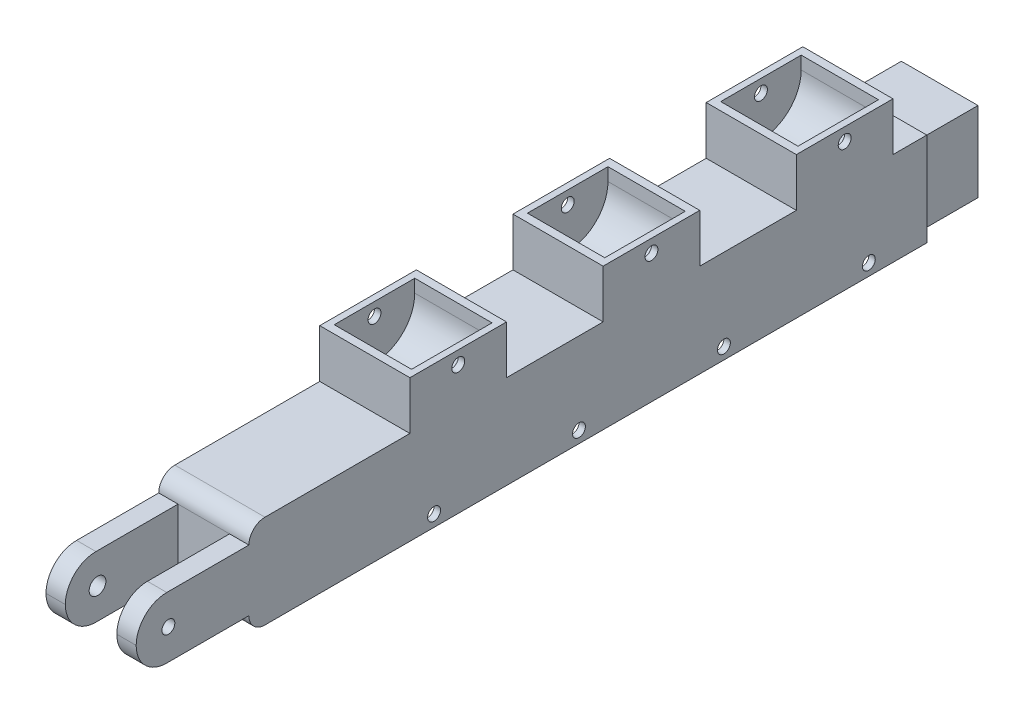
from build123d import *

# Parameters (mm, degrees)
SKETCH_1_W           = 250
SKETCH_1_H           = 29
SKETCH_1_W_2         = 30
SKETCH_1_H_2         = 15
EXTRUDE_1_DEPTH      = 28
SKETCH_1_3_R         = 2
CUT_EXTRUDE_1_DEPTH  = 132.450561049
CUT_EXTRUDE_START    = 2
SKETCH_1_5_R         = 2
CUT_EXTRUDE_2_DEPTH  = 24
SKETCH_3_W           = 6
SKETCH_3_H           = 19
EXTRUDE_2_DEPTH      = 35
SKETCH_3_3_W         = 6
SKETCH_3_3_H         = 19
EXTRUDE_3_DEPTH      = 35
SKETCH_1_6_R         = 2
CUT_EXTRUDE_3_DEPTH  = 166.088612569
CUT_EXTRUDE_7_REACH  = 167.089
SKETCH_1_8_R         = 2.6
FILLET_1_R           = 9.5
FILLET_2_R           = 5
SKETCH_4_R           = 5.1
CUT_EXTRUDE_4_DEPTH  = 31.5
SKETCH_4_2_OUTSIDE_W = 87.946
SKETCH_4_2_OUTSIDE_H = 103.946
SKETCH_4_2_OUTSIDE_R = 5.1
CUT_EXTRUDE_5_DEPTH  = 21.5
SKETCH_5_OUTSIDE_W   = 83.722
SKETCH_5_OUTSIDE_H   = 99.722
SKETCH_5_OUTSIDE_W_2 = 23.8
SKETCH_5_OUTSIDE_H_2 = 24.8
CUT_EXTRUDE_6_DEPTH  = 18


with BuildPart() as part:
    # 草图1 → 凸台-拉伸1 (new body)
    with BuildSketch(Plane(origin=(0, 0, 0), x_dir=(0, 0, -1), z_dir=(1, 0, 0))):
        Rectangle(SKETCH_1_W, SKETCH_1_H)
        with Locations((-60, 22)):
            Rectangle(SKETCH_1_W_2, SKETCH_1_H_2)
        with Locations((0, 22)):
            Rectangle(SKETCH_1_W_2, SKETCH_1_H_2)
        with Locations((60, 22)):
            Rectangle(SKETCH_1_W_2, SKETCH_1_H_2)
    extrude(amount=EXTRUDE_1_DEPTH)

    # 草图1<3> → 切除-拉伸1 (cut, through all)
    with BuildSketch(Plane(origin=(0, 0, 0), x_dir=(0, 0, -1), z_dir=(1, 0, 0))):
        with Locations((-67.5, -10.858617882)):
            Circle(SKETCH_1_3_R)
        with Locations((-22.5, -10.858617882)):
            Circle(SKETCH_1_3_R)
        with Locations((22.5, -10.858617882)):
            Circle(SKETCH_1_3_R)
        with Locations((-60, 25.5)):
            Circle(SKETCH_1_3_R)
        with Locations((67.5, -10.858617882)):
            Circle(SKETCH_1_3_R)
        with Locations((0, 25.5)):
            Circle(SKETCH_1_3_R)
        with Locations((60, 25.5)):
            Circle(SKETCH_1_3_R)
    extrude(amount=CUT_EXTRUDE_1_DEPTH, mode=Mode.SUBTRACT)

    # 草图1<5> → 切除-拉伸2 (cut)
    # profile 1 of 7: a face of its own
    with BuildSketch(Plane(origin=(0, 0, 0), x_dir=(0, 0, -1), z_dir=(1, 0, 0)).offset(CUT_EXTRUDE_START)):
        with BuildLine():
            Line((-72.5, 29.5), (-72.5, 25.5))
            ThreePointArc((-72.5, 25.5), (-60, 13), (-47.5, 25.5))
            Line((-47.5, 25.5), (-47.5, 29.5))
            Line((-47.5, 29.5), (-72.5, 29.5))
        make_face()
        with Locations((-60, 25.5)):
            Circle(SKETCH_1_5_R, mode=Mode.SUBTRACT)
    # profile 2 of 7: a face of its own
    with BuildSketch(Plane(origin=(0, 0, 0), x_dir=(0, 0, -1), z_dir=(1, 0, 0)).offset(CUT_EXTRUDE_START)):
        with BuildLine():
            Line((-79.457856675, -14.5), (-55.542143325, -14.5))
            ThreePointArc((-55.542143325, -14.5), (-67.5, 1.641382118), (-79.457856675, -14.5))
        make_face()
        with Locations((-67.5, -10.858617882)):
            Circle(SKETCH_1_5_R, mode=Mode.SUBTRACT)
    # profile 3 of 7: a face of its own
    with BuildSketch(Plane(origin=(0, 0, 0), x_dir=(0, 0, -1), z_dir=(1, 0, 0)).offset(CUT_EXTRUDE_START)):
        with BuildLine():
            Line((-34.457856675, -14.5), (-10.542143325, -14.5))
            ThreePointArc((-10.542143325, -14.5), (-22.5, 1.641382118), (-34.457856675, -14.5))
        make_face()
        with Locations((-22.5, -10.858617882)):
            Circle(SKETCH_1_5_R, mode=Mode.SUBTRACT)
    # profile 4 of 7: a face of its own
    with BuildSketch(Plane(origin=(0, 0, 0), x_dir=(0, 0, -1), z_dir=(1, 0, 0)).offset(CUT_EXTRUDE_START)):
        with BuildLine():
            ThreePointArc((-12.5, 25.5), (0, 13), (12.5, 25.5))
            Line((12.5, 25.5), (12.5, 29.5))
            Line((12.5, 29.5), (-12.5, 29.5))
            Line((-12.5, 29.5), (-12.5, 25.5))
        make_face()
        with Locations((0, 25.5)):
            Circle(SKETCH_1_5_R, mode=Mode.SUBTRACT)
    # profile 5 of 7: a face of its own
    with BuildSketch(Plane(origin=(0, 0, 0), x_dir=(0, 0, -1), z_dir=(1, 0, 0)).offset(CUT_EXTRUDE_START)):
        with BuildLine():
            Line((10.542143325, -14.5), (34.457856675, -14.5))
            ThreePointArc((34.457856675, -14.5), (22.5, 1.641382118), (10.542143325, -14.5))
        make_face()
        with Locations((22.5, -10.858617882)):
            Circle(SKETCH_1_5_R, mode=Mode.SUBTRACT)
    # profile 6 of 7: a face of its own
    with BuildSketch(Plane(origin=(0, 0, 0), x_dir=(0, 0, -1), z_dir=(1, 0, 0)).offset(CUT_EXTRUDE_START)):
        with BuildLine():
            Line((55.542143325, -14.5), (79.457856675, -14.5))
            ThreePointArc((79.457856675, -14.5), (67.5, 1.641382118), (55.542143325, -14.5))
        make_face()
        with Locations((67.5, -10.858617882)):
            Circle(SKETCH_1_5_R, mode=Mode.SUBTRACT)
    # profile 7 of 7: a face of its own
    with BuildSketch(Plane(origin=(0, 0, 0), x_dir=(0, 0, -1), z_dir=(1, 0, 0)).offset(CUT_EXTRUDE_START)):
        with BuildLine():
            ThreePointArc((47.5, 25.5), (60, 13), (72.5, 25.5))
            Line((72.5, 25.5), (72.5, 29.5))
            Line((72.5, 29.5), (47.5, 29.5))
            Line((47.5, 29.5), (47.5, 25.5))
        make_face()
        with Locations((60, 25.5)):
            Circle(SKETCH_1_5_R, mode=Mode.SUBTRACT)
    extrude(amount=CUT_EXTRUDE_2_DEPTH, mode=Mode.SUBTRACT)

    # 草图3 → 凸台-拉伸2 (add)
    with BuildSketch(Plane.XY.offset(125)):
        with Locations((25, 0)):
            Rectangle(SKETCH_3_W, SKETCH_3_H)
    extrude(amount=EXTRUDE_2_DEPTH)

    # 草图3<3> → 凸台-拉伸3 (add)
    with BuildSketch(Plane.XY.offset(125)):
        with Locations((25, 0)):
            Rectangle(SKETCH_3_3_W, SKETCH_3_3_H)
        with Locations((3, 0)):
            Rectangle(SKETCH_3_3_W, SKETCH_3_3_H)
    extrude(amount=EXTRUDE_3_DEPTH)

    # 草图1<6> → 切除-拉伸3 (cut, through all)
    with BuildSketch(Plane(origin=(0, 0, 0), x_dir=(0, 0, -1), z_dir=(1, 0, 0))):
        with Locations(Location((-150, 0, 0), (0, 0, 90))):
            Circle(SKETCH_1_6_R)
    extrude(amount=CUT_EXTRUDE_3_DEPTH, mode=Mode.SUBTRACT)

    # 草图1<8> → 切除-拉伸7 (cut, up to next)
    with BuildSketch(Plane(origin=(0, 0, 0), x_dir=(0, 0, -1), z_dir=(1, 0, 0)), mode=Mode.PRIVATE) as cut_extrude_7_sk1:
        with Locations(Location((-150, 0, 0), (0, 0, 180))):
            Circle(SKETCH_1_8_R)
    cut_extrude_7_tool1 = extrude(cut_extrude_7_sk1.sketch, amount=CUT_EXTRUDE_7_REACH, mode=Mode.PRIVATE) & part.part
    add(cut_extrude_7_tool1.solids().sort_by_distance((0, 0, 150))[0], mode=Mode.SUBTRACT)

    # 圆角1
    fillet_1_edges = [part.edges().sort_by_distance(p)[0] for p in [
        (25, 9.5, 160),
        (25, -9.5, 160),
        (3, -9.5, 160),
        (3, 9.5, 160),
    ]]
    fillet(fillet_1_edges, radius=FILLET_1_R - 0.0001)  # a hair under: the kernel refuses the full size

    # 圆角2
    fillet_2_edges = [part.edges().sort_by_distance(p)[0] for p in [
        (14, -14.5, 125),
        (14, 14.5, 125),
    ]]
    fillet(fillet_2_edges, radius=FILLET_2_R)

    # 草图4 → 切除-拉伸4 (cut)
    with BuildSketch(Plane(origin=(0, 0, -125), x_dir=(-1, 0, 0), z_dir=(0, 0, -1))):
        with Locations((-14, 0)):
            Circle(SKETCH_4_R)
    extrude(amount=-CUT_EXTRUDE_4_DEPTH, mode=Mode.SUBTRACT)

    # 草图4<2> outside → 切除-拉伸5 (cut)
    with BuildSketch(Plane(origin=(0, 0, -125), x_dir=(-1, 0, 0), z_dir=(0, 0, -1))):
        with Locations((-14, 7.5)):
            Rectangle(SKETCH_4_2_OUTSIDE_W, SKETCH_4_2_OUTSIDE_H)
        with Locations((-14, 0)):
            Circle(SKETCH_4_2_OUTSIDE_R, mode=Mode.SUBTRACT)
    extrude(amount=-CUT_EXTRUDE_5_DEPTH, mode=Mode.SUBTRACT)

    # 草图5 outside → 切除-拉伸6 (cut)
    with BuildSketch(Plane(origin=(0, 0, -103.5), x_dir=(-1, 0, 0), z_dir=(0, 0, -1))):
        with Locations((-14, 7.5)):
            Rectangle(SKETCH_5_OUTSIDE_W, SKETCH_5_OUTSIDE_H)
        with Locations((-14, 0)):
            Rectangle(SKETCH_5_OUTSIDE_W_2, SKETCH_5_OUTSIDE_H_2, mode=Mode.SUBTRACT)
    extrude(amount=-CUT_EXTRUDE_6_DEPTH, mode=Mode.SUBTRACT)


solid = part.part
